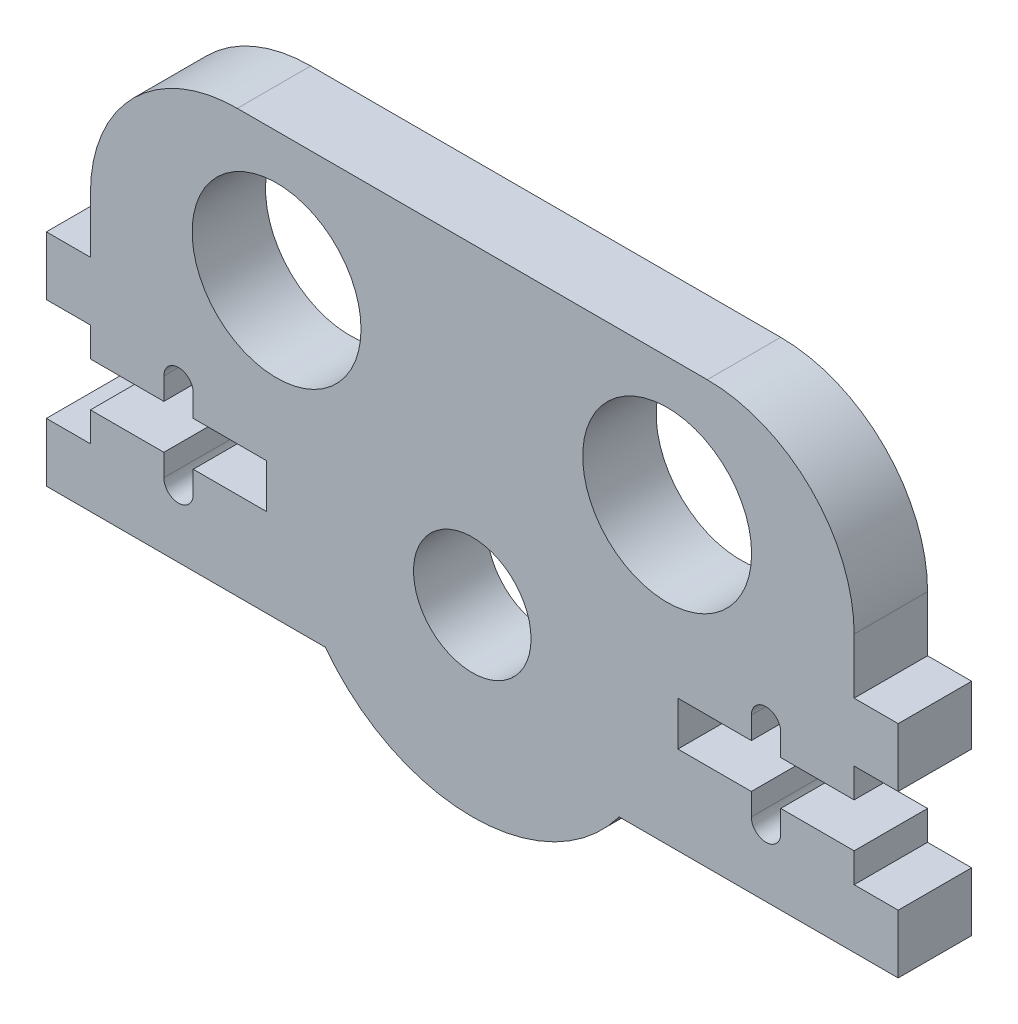
from build123d import *

# Parameters (mm, degrees)
BOSS_EXTRUDE1_DEPTH = 5
SKETCH2_R           = 4
CUT_EXTRUDE1_DEPTH  = 5
BOSS_EXTRUDE2_START = -5
BOSS_EXTRUDE2_DEPTH = 5
CUT_EXTRUDE2_START  = -10
SKETCH3_3_R         = 5.75
CUT_EXTRUDE2_DEPTH  = 10
SKETCH4_W           = 3
SKETCH4_H           = 4
BOSS_EXTRUDE3_DEPTH = 5


with BuildPart() as part:
    # Sketch1 → Boss-Extrude1 (new body)
    with BuildSketch(Plane.XY):
        with BuildLine():
            Line((10, -7.5), (26, -7.5))
            Line((26, -7.5), (26, -1.5))
            Line((26, -1.5), (21, -1.5))
            Line((21, -1.5), (21, -3))
            ThreePointArc((21, -3), (20, -4), (19, -3))
            Line((19, -3), (19, -1.5))
            Line((19, -1.5), (14, -1.5))
            Line((14, -1.5), (14, 1.5))
            Line((14, 1.5), (19, 1.5))
            Line((19, 1.5), (19, 3))
            ThreePointArc((19, 3), (20, 4), (21, 3))
            Line((21, 3), (21, 1.5))
            Line((21, 1.5), (26, 1.5))
            Line((26, 1.5), (26, 7.5))
            Line((26, 7.5), (10, 7.5))
            ThreePointArc((10, 7.5), (0, 12.5), (-10, 7.5))
            Line((-10, 7.5), (-26, 7.5))
            Line((-26, 7.5), (-26, 1.5))
            Line((-26, 1.5), (-21, 1.5))
            Line((-21, 1.5), (-21, 3))
            ThreePointArc((-21, 3), (-20, 4), (-19, 3))
            Line((-19, 3), (-19, 1.5))
            Line((-19, 1.5), (-14, 1.5))
            Line((-14, 1.5), (-14, -1.5))
            Line((-14, -1.5), (-19, -1.5))
            Line((-19, -1.5), (-19, -3))
            ThreePointArc((-19, -3), (-20, -4), (-21, -3))
            Line((-21, -3), (-21, -1.5))
            Line((-21, -1.5), (-26, -1.5))
            Line((-26, -1.5), (-26, -7.5))
            Line((-26, -7.5), (-10, -7.5))
            ThreePointArc((-10, -7.5), (0, -12.5), (10, -7.5))
        make_face()
    extrude(amount=BOSS_EXTRUDE1_DEPTH)

    # Sketch2 → Cut-Extrude1 (cut)
    with BuildSketch(Plane.XY.offset(5)):
        Circle(SKETCH2_R)
    extrude(amount=-CUT_EXTRUDE1_DEPTH, mode=Mode.SUBTRACT)

    # Sketch3 → Boss-Extrude2 (add)
    with BuildSketch(Plane.XY.offset(5).offset(BOSS_EXTRUDE2_START)):
        with BuildLine():
            Line((-10.433115283, 7.5), (-10, 7.5))
            ThreePointArc((-10, 7.5), (-9.57776888, 8.032206626), (-9.127247451, 8.540688144))
            ThreePointArc((-9.127247451, 8.540688144), (-9.742202524, 7.972687768), (-10.433115283, 7.5))
        make_face()
        with BuildLine():
            ThreePointArc((9.087890987, 8.582554247), (9.559282217, 8.054199122), (10, 7.5))
            Line((10, 7.5), (10.483311668, 7.5))
            ThreePointArc((10.483311668, 7.5), (9.743790216, 7.987382281), (9.087890987, 8.582554247))
        make_face()
        with BuildLine():
            ThreePointArc((-16.21844708, 7.5), (-14.160694741, 18.15846617), (-9.127247451, 8.540688144))
            ThreePointArc((-9.127247451, 8.540688144), (-0.028730219, 12.499966983), (9.087890987, 8.582554247))
            ThreePointArc((9.087890987, 8.582554247), (14.151372759, 18.212317567), (16.053330067, 7.5))
            Line((16.053330067, 7.5), (26, 7.5))
            Line((26, 7.5), (26, 11.280529173))
            ThreePointArc((26, 11.280529173), (23.071067812, 18.351596985), (16, 21.280529173))
            Line((16, 21.280529173), (-16, 21.280529173))
            ThreePointArc((-16, 21.280529173), (-23.071067812, 18.351596985), (-26, 11.280529173))
            Line((-26, 11.280529173), (-26, 7.5))
            Line((-26, 7.5), (-16.21844708, 7.5))
        make_face()
    extrude(amount=BOSS_EXTRUDE2_DEPTH)

    # Sketch3<3> → Cut-Extrude2 (cut)
    with BuildSketch(Plane.XY.offset(5).offset(CUT_EXTRUDE2_START)):
        with Locations((-13.325781182, 12.469404793)):
            Circle(SKETCH3_3_R)
        with Locations((13.268320868, 12.530529173)):
            Circle(SKETCH3_3_R)
    extrude(amount=CUT_EXTRUDE2_DEPTH, mode=Mode.SUBTRACT)

    # Sketch4 → Boss-Extrude3 (add)
    with BuildSketch(Plane.XY.offset(5)):
        with Locations((-27.5, 5.5)):
            Rectangle(SKETCH4_W, SKETCH4_H)
        with Locations((-27.5, -5.5)):
            Rectangle(SKETCH4_W, SKETCH4_H)
    boss_extrude3 = extrude(amount=-BOSS_EXTRUDE3_DEPTH)

    # Mirror1: Boss-Extrude3 across plane
    add(boss_extrude3.mirror(Plane(origin=(0, 0, 0), x_dir=(0, 0, 1), z_dir=(1, 0, 0))))


solid = part.part
